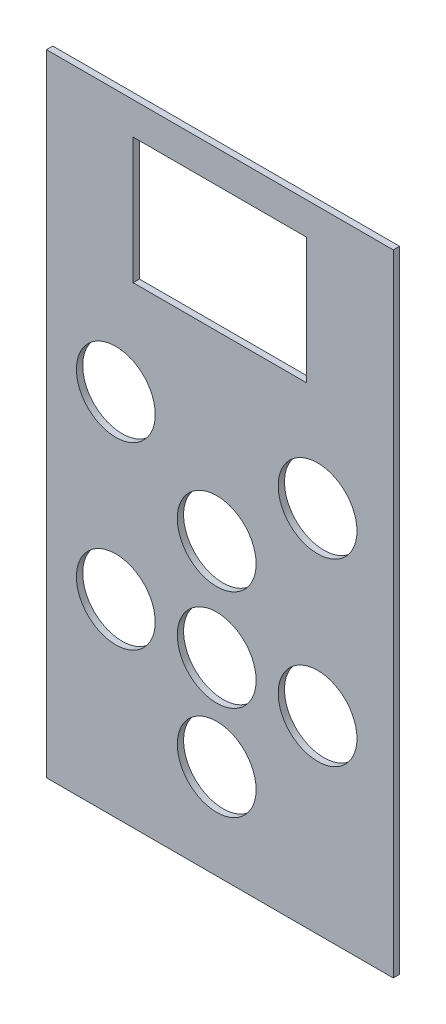
from build123d import *

# Parameters (mm, degrees)
SKETCH_1_W      = 55
SKETCH_1_H      = 100
SKETCH_1_R      = 6.25
SKETCH_1_W_2    = 27.5
SKETCH_1_H_2    = 20
EXTRUDE_1_DEPTH = 1


with BuildPart() as part:
    # 草图1 → 凸台-拉伸1 (new body)
    with BuildSketch(Plane.XY):
        with Locations((37.918181818, -46.951515152)):
            Rectangle(SKETCH_1_W, SKETCH_1_H)
        with Locations((37.418181818, -81.951515152)):
            Circle(SKETCH_1_R, mode=Mode.SUBTRACT)
        with Locations((37.418181818, -66.951515152)):
            Circle(SKETCH_1_R, mode=Mode.SUBTRACT)
        with Locations((21.418181818, -66.951515152)):
            Circle(SKETCH_1_R, mode=Mode.SUBTRACT)
        with Locations((53.418181818, -66.951515152)):
            Circle(SKETCH_1_R, mode=Mode.SUBTRACT)
        with Locations((37.418181818, -50.951515152)):
            Circle(SKETCH_1_R, mode=Mode.SUBTRACT)
        with Locations((53.418181818, -38.451515152)):
            Circle(SKETCH_1_R, mode=Mode.SUBTRACT)
        with Locations((21.418181818, -38.451515152)):
            Circle(SKETCH_1_R, mode=Mode.SUBTRACT)
        with Locations((37.918181818, -12.084434283)):
            Rectangle(SKETCH_1_W_2, SKETCH_1_H_2, mode=Mode.SUBTRACT)
    extrude(amount=EXTRUDE_1_DEPTH)


solid = part.part
